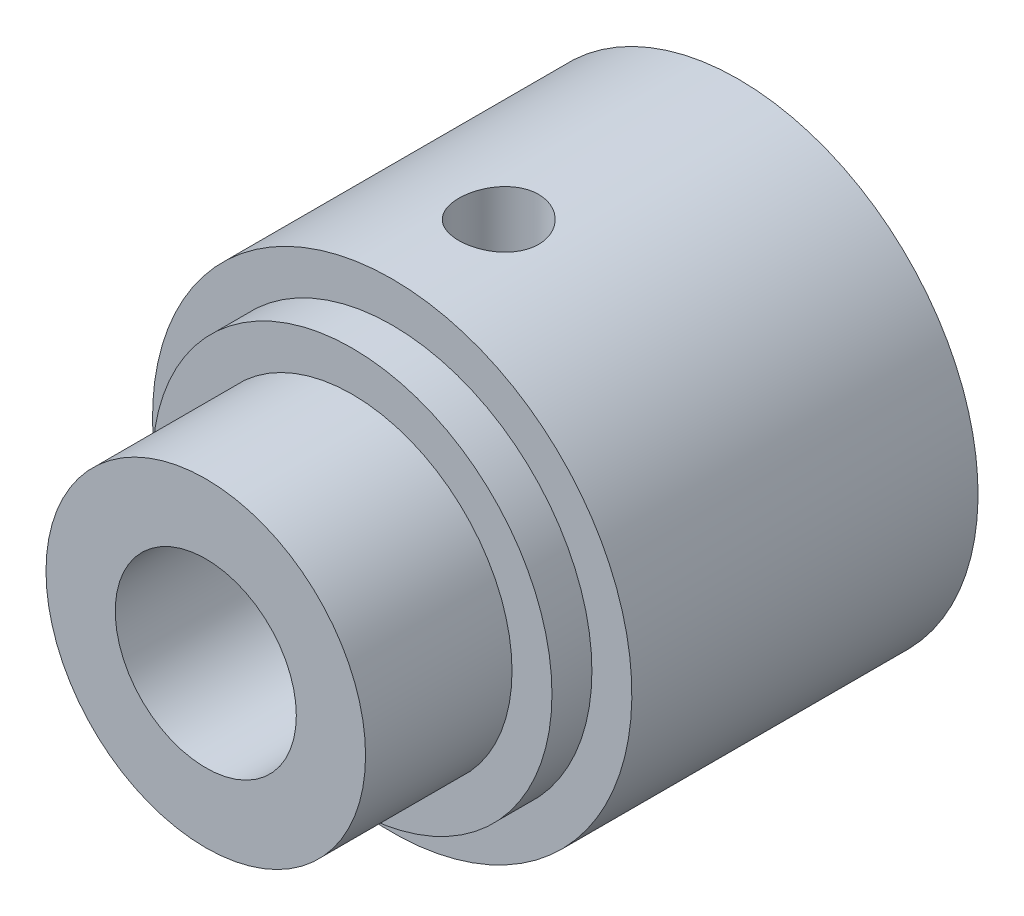
from build123d import *

# Parameters (mm, degrees)
CUT_EXTRUDE1_REACH               = 25.707
SKETCH2_R                        = 1.5
CUT_EXTRUDE1_DIRECTION_2_REACH   = 25.707
TAP_DRILL_FOR_M8X1_25_TAP2_D     = 6.8
TAP_DRILL_FOR_M8X1_25_TAP2_DEPTH = 10
TAP_DRILL_FOR_M8X1_25_TAP2_TIP   = 2.042926105


with BuildPart() as part:
    # Sketch1 → Revolve1 (revolve)
    with BuildSketch(Plane(origin=(0, 0, 0), x_dir=(0, 0, -1), z_dir=(1, 0, 0))):
        Polygon((0, 0), (0, 6), (5.5, 6), (5.5, 7.5), (7, 7.5), (7, 9), (20, 9), (20, 4.2), (9.5, 4.2), (6.9763854, 0), align=None)
    revolve(axis=Axis((0, 0, -6.9763854), (0, 0, 1)))

    # Sketch2 → Cut-Extrude1 (cut, up to next)
    with BuildSketch(Plane(origin=(0, 0, 0), x_dir=(1, 0, 0), z_dir=(0, 1, 0)), mode=Mode.PRIVATE) as cut_extrude1_sk1:
        with Locations((0, 11)):
            Circle(SKETCH2_R)
    cut_extrude1_tool1 = extrude(cut_extrude1_sk1.sketch, amount=-CUT_EXTRUDE1_REACH, mode=Mode.PRIVATE) & part.part
    add(cut_extrude1_tool1.solids().sort_by_distance((0, 0, -11))[0], mode=Mode.SUBTRACT)

    # Sketch2 → Cut-Extrude1 direction 2 (cut, up to next)
    with BuildSketch(Plane(origin=(0, 0, 0), x_dir=(1, 0, 0), z_dir=(0, 1, 0)), mode=Mode.PRIVATE) as cut_extrude1_direction_2_sk1:
        with Locations((0, 11)):
            Circle(SKETCH2_R)
    cut_extrude1_direction_2_tool1 = extrude(cut_extrude1_direction_2_sk1.sketch, amount=CUT_EXTRUDE1_DIRECTION_2_REACH, mode=Mode.PRIVATE) & part.part
    add(cut_extrude1_direction_2_tool1.solids().sort_by_distance((0, 0, -11))[0], mode=Mode.SUBTRACT)

    # Tap Drill for M8x1.25 Tap2
    with Locations(Plane.XY):
        with Locations((0, 0)):
            Hole(TAP_DRILL_FOR_M8X1_25_TAP2_D / 2, depth=TAP_DRILL_FOR_M8X1_25_TAP2_DEPTH)
            with Locations((0, 0, -(TAP_DRILL_FOR_M8X1_25_TAP2_DEPTH + TAP_DRILL_FOR_M8X1_25_TAP2_TIP / 2))):  # 118° drill point
                Cone(0, TAP_DRILL_FOR_M8X1_25_TAP2_D / 2, TAP_DRILL_FOR_M8X1_25_TAP2_TIP, mode=Mode.SUBTRACT)


solid = part.part
